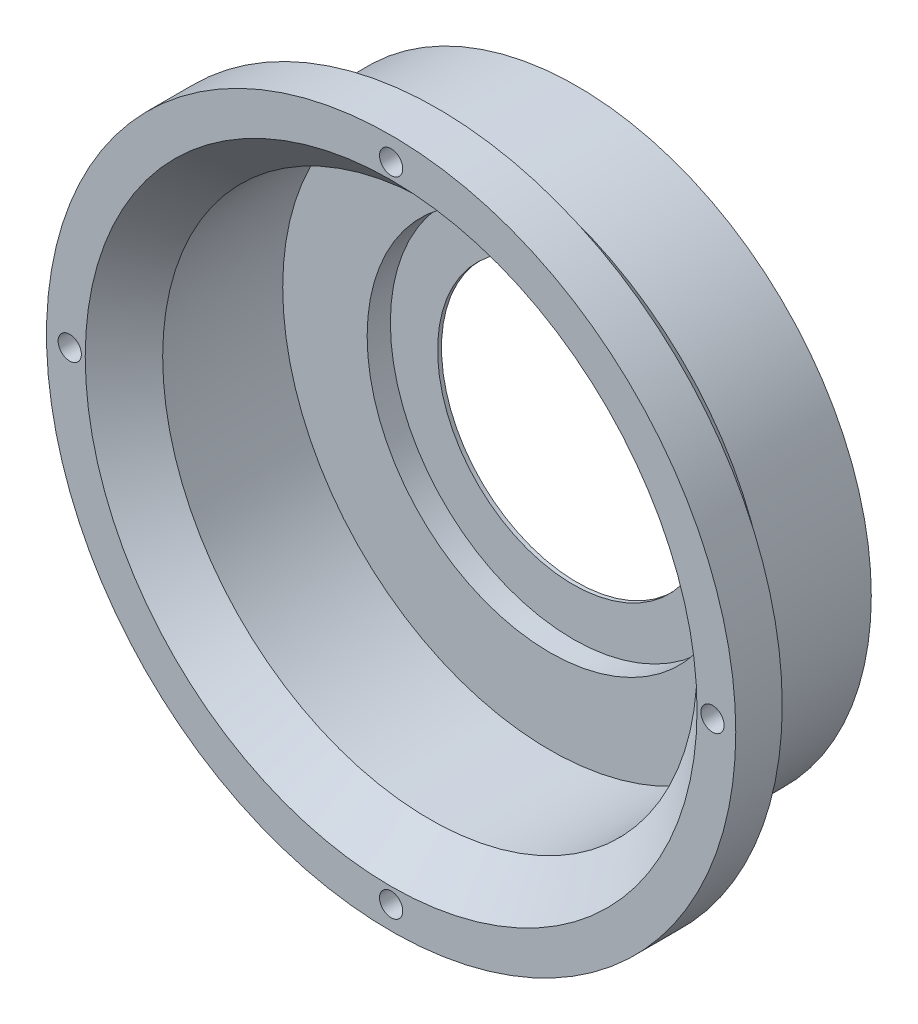
from build123d import *

# Parameters (mm, degrees)
SKETCH1_R           = 38
BOSS_EXTRUDE1_DEPTH = 24
SHELL1_T            = -3.5
SKETCH2_R           = 23.6
CUT_EXTRUDE1_DEPTH  = 3
SKETCH3_R           = 17.5
CUT_EXTRUDE2_DEPTH  = 0.5
BOSS_EXTRUDE2_START = -6
SKETCH4_R           = 44.5
SKETCH4_R_2         = 38
BOSS_EXTRUDE2_DEPTH = 6
SKETCH5_R           = 1.5
CUT_EXTRUDE3_DEPTH  = 6
CHAMFER1_SIZE       = 5


with BuildPart() as part:
    # Sketch1 → Boss-Extrude1 (new body)
    with BuildSketch(Plane.XY):
        Circle(SKETCH1_R)
    extrude(amount=BOSS_EXTRUDE1_DEPTH)

    # Shell1
    shell1_openings = [part.faces().sort_by_distance(p)[0] for p in [
        (0, 0, 24),
    ]]
    offset(amount=SHELL1_T, openings=shell1_openings, kind=Kind.INTERSECTION)

    # Sketch2 → Cut-Extrude1 (cut)
    with BuildSketch(Plane.XY.offset(3.5)):
        Circle(SKETCH2_R)
    extrude(amount=-CUT_EXTRUDE1_DEPTH, mode=Mode.SUBTRACT)

    # Sketch3 → Cut-Extrude2 (cut)
    with BuildSketch(Plane.XY.offset(0.5)):
        Circle(SKETCH3_R)
    extrude(amount=-CUT_EXTRUDE2_DEPTH, mode=Mode.SUBTRACT)

    # Sketch4 → Boss-Extrude2 (add)
    with BuildSketch(Plane.XY.offset(24).offset(BOSS_EXTRUDE2_START)):
        Circle(SKETCH4_R)
        Circle(SKETCH4_R_2, mode=Mode.SUBTRACT)
    extrude(amount=BOSS_EXTRUDE2_DEPTH)

    # Sketch5 → Cut-Extrude3 (cut)
    with BuildSketch(Plane.XY.offset(24)):
        with Locations((0, -41.5)):
            Circle(SKETCH5_R)
        with Locations((-41.5, 0)):
            Circle(SKETCH5_R)
        with Locations((0, 41.5)):
            Circle(SKETCH5_R)
        with Locations((41.5, 0)):
            Circle(SKETCH5_R)
    extrude(amount=-CUT_EXTRUDE3_DEPTH, mode=Mode.SUBTRACT)

    # Chamfer1
    chamfer1_edges = [part.edges().sort_by_distance(p)[0] for p in [
        (-34.5, 0, 24),
    ]]
    chamfer(chamfer1_edges, length=CHAMFER1_SIZE)

    # Chamfer2
    # the kernel refuses this chamfer: 5 mm, written as the material it adds along each edge
    with BuildSketch(Plane(origin=(0, 0, 18), x_dir=(1, 0, 0), z_dir=(0, -1, 0))) as chamfer2_piece_1_section:
        with BuildLine():
            Line((43.141421356, 0.141421356), (37.858578644, -5.141421356))
            Line((37.858578644, -5.141421356), (37.758578644, -5.141421356))
            ThreePointArc((37.758578644, -5.141421356), (37.9, -2.570710678), (37.9, 0))
            Line((37.9, 0), (38, 0.1))
            ThreePointArc((38, 0.1), (40.570710678, 0.1), (43.141421356, 0.241421356))
            Line((43.141421356, 0.241421356), (43.141421356, 0.141421356))
        make_face()
    chamfer2_piece_1 = revolve(axis=Axis((0, 0, 18), (0, 0, 1)), mode=Mode.PRIVATE)
    chamfer2_piece_1 = chamfer2_piece_1 - Plane(origin=(0, -41.5, 17.367076612), x_dir=(1, 0, 0), z_dir=(0, 0, 1)) * Cylinder(1.5, 173, mode=Mode.PRIVATE)
    chamfer2_piece_1 = chamfer2_piece_1 - Plane(origin=(41.5, 0, 17.367076612), x_dir=(1, 0, 0), z_dir=(0, 0, 1)) * Cylinder(1.5, 173, mode=Mode.PRIVATE)
    chamfer2_piece_1 = chamfer2_piece_1 - Plane(origin=(-41.5, 0, 17.367076612), x_dir=(1, 0, 0), z_dir=(0, 0, 1)) * Cylinder(1.5, 173, mode=Mode.PRIVATE)
    chamfer2_piece_1 = chamfer2_piece_1 - Plane(origin=(0, 41.5, 17.367076612), x_dir=(1, 0, 0), z_dir=(0, 0, 1)) * Cylinder(1.5, 173, mode=Mode.PRIVATE)
    add(chamfer2_piece_1)


solid = part.part
